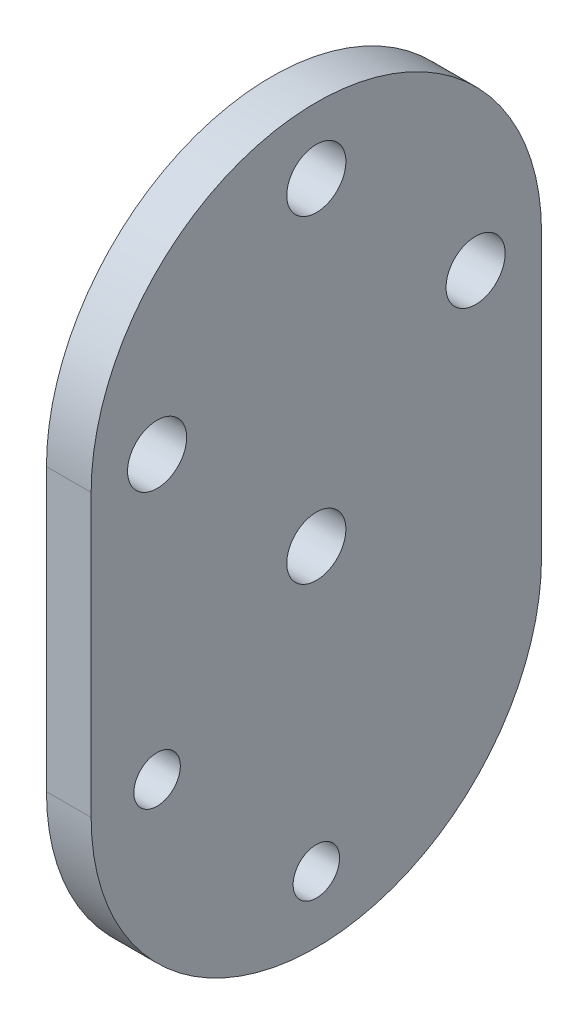
from build123d import *

# Parameters (mm, degrees)
SKETCH2_R           = 2.1
SKETCH2_R_2         = 1.65
BOSS_EXTRUDE1_DEPTH = 3.175


with BuildPart() as part:
    # Sketch2 → Boss-Extrude1 (new body)
    with BuildSketch(Plane(origin=(0, 0, 0), x_dir=(0, 0, -1), z_dir=(1, 0, 0))):
        with BuildLine():
            Line((-16, 10), (-16, -10))
            ThreePointArc((-16, -10), (0, -26), (16, -10))
            Line((16, -10), (16, 10))
            ThreePointArc((16, 10), (0, 26), (-16, 10))
        make_face()
        with Locations((0, -1.313708499)):
            Circle(SKETCH2_R, mode=Mode.SUBTRACT)
        with Locations((0, -21.313708499)):
            Circle(SKETCH2_R_2, mode=Mode.SUBTRACT)
        with Locations((-11.313708499, -10)):
            Circle(SKETCH2_R_2, mode=Mode.SUBTRACT)
        with Locations((0, 21.313708499)):
            Circle(SKETCH2_R, mode=Mode.SUBTRACT)
        with Locations((-11.313708499, 10)):
            Circle(SKETCH2_R, mode=Mode.SUBTRACT)
        with Locations((11.313708499, 10)):
            Circle(SKETCH2_R, mode=Mode.SUBTRACT)
    extrude(amount=BOSS_EXTRUDE1_DEPTH)


solid = part.part
